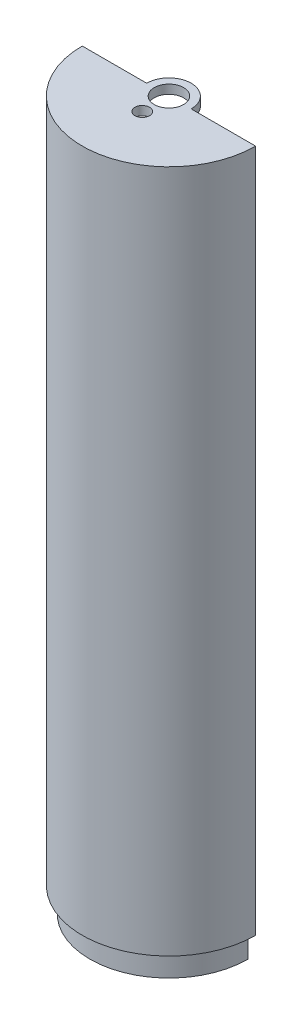
from build123d import *
from build123d.topology import SkipClean

# Parameters (mm, degrees)
BOSS_EXTRUDE1_DEPTH      = 3.81
BOSS_EXTRUDE1_DEPTH_BACK = 6.35
SKETCH1_R                = 49.4538
SKETCH2_R                = 49.4538
BOSS_EXTRUDE2_DEPTH      = 381
SHELL1_T                 = -3.175
CUT_EXTRUDE1_DEPTH       = 398.363186857
BOSS_EXTRUDE3_DEPTH      = 3.81
SKETCH7_R                = 49.4538
SKETCH7_R_2              = 45.085
CUT_EXTRUDE2_DEPTH       = 6.35
BOSS_EXTRUDE4_START      = 7.62
BOSS_EXTRUDE4_DEPTH      = 7.62
SKETCH10_R               = 35.56
CUT_EXTRUDE3_DEPTH       = 6.35
SKETCH11_R               = 8.382
CUT_EXTRUDE4_DEPTH       = 5.08
SKETCH12_R               = 3.302
CUT_EXTRUDE5_DEPTH       = 402.739558289
BOSS_EXTRUDE5_DEPTH      = 5.08
SKETCH14_R               = 4.191
CUT_EXTRUDE6_DEPTH       = 405.866453376
BOSS_EXTRUDE6_DEPTH      = 5.08
SKETCH16_R               = 8.382
CUT_EXTRUDE7_DEPTH       = 405.866453376
CUT_EXTRUDE8_REACH       = 411.871
SKETCH17_R               = 4.191


with BuildPart() as part:
    # Sketch1 → Boss-Extrude1 (new, two sides: drawn at the far end of the back side and taken through both)
    with BuildSketch(Plane(origin=(0, 0, 0), x_dir=(1, 0, 0), z_dir=(0, 1, 0)).offset(-BOSS_EXTRUDE1_DEPTH_BACK)):
        Circle(SKETCH1_R)
    extrude(amount=BOSS_EXTRUDE1_DEPTH + BOSS_EXTRUDE1_DEPTH_BACK)

    # Sketch2 → Boss-Extrude2 (add)
    with BuildSketch(Plane(origin=(0, 3.81, 0), x_dir=(1, 0, 0), z_dir=(0, 1, 0))):
        Circle(SKETCH2_R)
    extrude(amount=BOSS_EXTRUDE2_DEPTH)

    # Shell1
    shell1_openings = [part.faces().sort_by_distance(p)[0] for p in [
        (0, 384.81, 0),
    ]]
    offset(amount=SHELL1_T, openings=shell1_openings, kind=Kind.INTERSECTION)

    # Sketch4 → Cut-Extrude1 (cut, through all)
    with BuildSketch(Plane.XZ.offset(6.35)):
        with BuildLine():
            Line((49.4538, 0), (12.7, 0))
            ThreePointArc((12.7, 0), (0, -12.7), (-12.7, 0))
            Line((-12.7, 0), (-49.4538, 0))
            ThreePointArc((-49.4538, 0), (0, -49.4538), (49.4538, 0))
        make_face()
    extrude(amount=-CUT_EXTRUDE1_DEPTH, mode=Mode.SUBTRACT)

    # Sketch5 → Boss-Extrude3 (add)
    with BuildSketch(Plane(origin=(0, -3.175, 0), x_dir=(1, 0, 0), z_dir=(0, 1, 0))):
        with BuildLine():
            Line((-46.2788, 0), (-12.7, 0))
            ThreePointArc((-12.7, 0), (0, 12.7), (12.7, 0))
            Line((12.7, 0), (46.2788, 0))
            ThreePointArc((46.2788, 0), (0, -46.2788), (-46.2788, 0))
        make_face()
    extrude(amount=BOSS_EXTRUDE3_DEPTH)

    # Sketch7 → Cut-Extrude2 (cut)
    with BuildSketch(Plane.XZ.offset(6.35)):
        Circle(SKETCH7_R)
        Circle(SKETCH7_R_2, mode=Mode.SUBTRACT)
    extrude(amount=-CUT_EXTRUDE2_DEPTH, mode=Mode.SUBTRACT)

    # Sketch9 → Boss-Extrude4 (add)
    with SkipClean():  # the faces are left unmerged after this step: merging them gives an invalid solid
        with BuildSketch(Plane.XZ.offset(6.35).offset(BOSS_EXTRUDE4_START)):
            with BuildLine():
                Line((45.085, 0), (12.7, 0))
                ThreePointArc((12.7, 0), (0, -12.7), (-12.7, 0))
                Line((-12.7, 0), (-45.085, 0))
                ThreePointArc((-45.085, 0), (0, 45.085), (45.085, 0))
            make_face()
        extrude(amount=-BOSS_EXTRUDE4_DEPTH)
    add(part.part.scale(1), mode=Mode.REPLACE)  # the faces are merged on a copy

    # Sketch10 → Cut-Extrude3 (cut)
    with BuildSketch(Plane(origin=(0, 0.635, 0), x_dir=(1, 0, 0), z_dir=(0, 1, 0))):
        Circle(SKETCH10_R)
    extrude(amount=-CUT_EXTRUDE3_DEPTH, mode=Mode.SUBTRACT)

    # Sketch11 → Cut-Extrude4 (cut)
    with BuildSketch(Plane(origin=(0, -5.715, 0), x_dir=(1, 0, 0), z_dir=(0, 1, 0))):
        Circle(SKETCH11_R)
    extrude(amount=-CUT_EXTRUDE4_DEPTH, mode=Mode.SUBTRACT)

    # Sketch12 → Cut-Extrude5 (cut, through all)
    with BuildSketch(Plane(origin=(0, -10.795, 0), x_dir=(1, 0, 0), z_dir=(0, 1, 0))):
        Circle(SKETCH12_R)
    extrude(amount=-CUT_EXTRUDE5_DEPTH, mode=Mode.SUBTRACT)

    # Sketch13 → Boss-Extrude5 (add)
    with SkipClean():  # the faces are left unmerged after this step: merging them gives an invalid solid
        with BuildSketch(Plane(origin=(0, 0.635, 0), x_dir=(1, 0, 0), z_dir=(0, 1, 0))):
            with BuildLine():
                Line((-46.2788, 0), (-35.56, 0))
                ThreePointArc((-35.56, 0), (0, -35.56), (35.56, 0))
                Line((35.56, 0), (46.2788, 0))
                ThreePointArc((46.2788, 0), (0, -46.2788), (-46.2788, 0))
            make_face()
        extrude(amount=BOSS_EXTRUDE5_DEPTH)
    add(part.part.scale(1), mode=Mode.REPLACE)  # the faces are merged on a copy

    # Sketch14 → Cut-Extrude6 (cut, through all)
    with BuildSketch(Plane.XZ.offset(13.97)):
        with Locations((0, 15.24)):
            Circle(SKETCH14_R)
    extrude(amount=-CUT_EXTRUDE6_DEPTH, mode=Mode.SUBTRACT)

    # Sketch15 → Boss-Extrude6 (add)
    with SkipClean():  # the faces are left unmerged after this step: merging them gives an invalid solid
        with BuildSketch(Plane(origin=(0, 384.81, 0), x_dir=(1, 0, 0), z_dir=(0, 1, 0))):
            with BuildLine():
                Line((46.2788, 0), (35.56, 0))
                Line((35.56, 0), (12.7, 0))
                ThreePointArc((12.7, 0), (0, 12.7), (-12.7, 0))
                Line((-12.7, 0), (-35.56, 0))
                Line((-35.56, 0), (-46.2788, 0))
                Line((-46.2788, 0), (-49.4538, 0))
                ThreePointArc((-49.4538, 0), (0, -49.4538), (49.4538, 0))
                Line((49.4538, 0), (46.2788, 0))
            make_face()
        extrude(amount=BOSS_EXTRUDE6_DEPTH)

    # Sketch16 → Cut-Extrude7 (cut, through all)
    with SkipClean():  # the faces are left unmerged after this step: merging them gives an invalid solid
        with BuildSketch(Plane.XZ.offset(-384.81)):
            Circle(SKETCH16_R)
        extrude(amount=-CUT_EXTRUDE7_DEPTH, mode=Mode.SUBTRACT)

    # Sketch17 → Cut-Extrude8 (cut, up to next)
    with BuildSketch(Plane(origin=(0, 389.89, 0), x_dir=(1, 0, 0), z_dir=(0, 1, 0)), mode=Mode.PRIVATE) as cut_extrude8_sk1:
        with Locations((0, -15.24)):
            Circle(SKETCH17_R)
    cut_extrude8_tool1 = extrude(cut_extrude8_sk1.sketch, amount=-CUT_EXTRUDE8_REACH, mode=Mode.PRIVATE) & part.part
    add(cut_extrude8_tool1.solids().sort_by_distance((0, 389.89, 15.24))[0], mode=Mode.SUBTRACT)


solid = part.part
